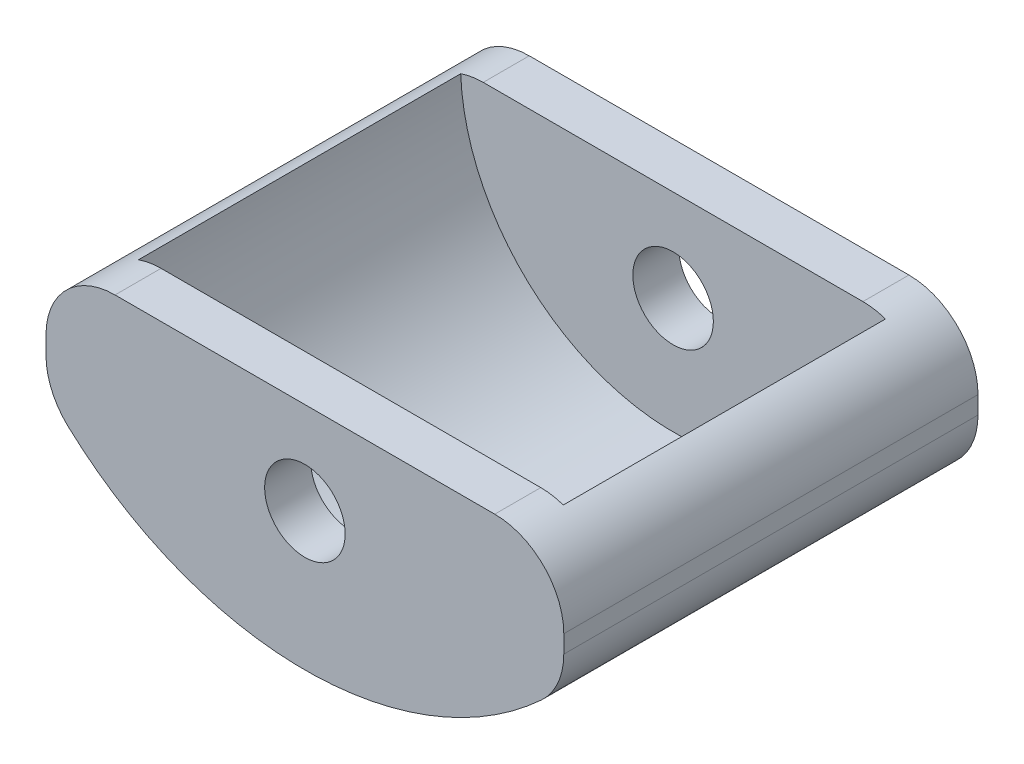
from build123d import *

# Parameters (mm, degrees)
SKETCH1_W               = 22.5
SKETCH1_H               = 18
BOSS_EXTRUDE1_DEPTH     = 10
CUT_EXTRUDE1_DEPTH      = 24.464068275
CUT_EXTRUDE1_DEPTH_BACK = 24.464068275
SKETCH2_R               = 1.75
CUT_EXTRUDE2_DEPTH      = 14
CUT_EXTRUDE3_REACH      = 19.532
SKETCH4_W               = 11.529065942
SKETCH4_H               = 14
FILLET1_R               = 3


with BuildPart() as part:
    # Sketch1 → Boss-Extrude1 (new body)
    with BuildSketch(Plane(origin=(0, 0, 0), x_dir=(1, 0, 0), z_dir=(0, 1, 0))):
        Rectangle(SKETCH1_W, SKETCH1_H)
    extrude(amount=BOSS_EXTRUDE1_DEPTH)

    # Sketch2 → Cut-Extrude1 (cut, two sides: drawn at the far end of the back side and taken through both)
    with BuildSketch(Plane.XY.offset(9).offset(-CUT_EXTRUDE1_DEPTH_BACK)):
        with Locations((0, 6)):
            Circle(SKETCH2_R)
        with BuildLine():
            Line((-11.25, 5), (-11.25, 0))
            Line((-11.25, 0), (11.25, 0))
            Line((11.25, 0), (11.25, 5))
            ThreePointArc((11.25, 5), (0, 0.01), (-11.25, 5))
        make_face()
    extrude(amount=CUT_EXTRUDE1_DEPTH + CUT_EXTRUDE1_DEPTH_BACK, mode=Mode.SUBTRACT)

    # Sketch3 → Cut-Extrude2 (cut)
    with BuildSketch(Plane.XY.offset(7)):
        with BuildLine():
            ThreePointArc((-9.233945582, 9.952114837), (0, 0.969656164), (9.233945582, 9.952114837))
            ThreePointArc((9.233945582, 9.952114837), (7.547885163, 11.733945582), (5.766054418, 10.047885163))
            ThreePointArc((5.766054418, 10.047885163), (0, 4.438869486), (-5.766054418, 10.047885163))
            ThreePointArc((-5.766054418, 10.047885163), (-7.547885163, 11.733945582), (-9.233945582, 9.952114837))
        make_face()
    extrude(amount=-CUT_EXTRUDE2_DEPTH, mode=Mode.SUBTRACT)

    # Sketch4 → Cut-Extrude3 (cut, up to next)
    with BuildSketch(Plane(origin=(0, 10, 0), x_dir=(1, 0, 0), z_dir=(0, 1, 0)), mode=Mode.PRIVATE) as cut_extrude3_sk1:
        Rectangle(SKETCH4_W, SKETCH4_H)
    cut_extrude3_tool1 = extrude(cut_extrude3_sk1.sketch, amount=-CUT_EXTRUDE3_REACH, mode=Mode.PRIVATE) & part.part
    add(cut_extrude3_tool1.solids().sort_by_distance((0, 10, 0))[0], mode=Mode.SUBTRACT)

    # Fillet1
    # the kernel refuses this fillet: 3 mm, written as the material it takes off along each edge
    with BuildSketch(Plane(origin=(11.25, 5, 12.435069568), x_dir=(0, 1, 0), z_dir=(0, 0, -1))) as fillet1_piece_1:
        with BuildLine():
            CenterArc((1.230754269, -3), FILLET1_R, 90, 47.349204062)
            ThreePointArc((-0.975735859, -0.967415115), (-0.498821765, -0.472659508), (0, 0))
            Line((0, 0), (1.230754269, 0))
        make_face()
    extrude(amount=24.870139136, mode=Mode.SUBTRACT)
    with BuildSketch(Plane(origin=(-11.25, 5, 12.435069568), x_dir=(0, 1, 0), z_dir=(0, 0, -1))) as fillet1_piece_2:
        with BuildLine():
            CenterArc((1.230754269, 3), FILLET1_R, 222.650795938, 47.349204062)
            ThreePointArc((-0.975735859, 0.967415115), (-0.498821765, 0.472659508), (0, 0))
            Line((0, 0), (1.230754269, 0))
        make_face()
    extrude(amount=24.870139136, mode=Mode.SUBTRACT)
    with BuildSketch(Plane(origin=(11.25, 10, -16.5), x_dir=(-1, 0, 0), z_dir=(0, 0, 1))) as fillet1_piece_3:
        with BuildLine():
            CenterArc((FILLET1_R, FILLET1_R), FILLET1_R, 180, 90)
            Line((0, FILLET1_R), (0, 0))
            Line((0, 0), (FILLET1_R, 0))
        make_face()
    extrude(amount=33, mode=Mode.SUBTRACT)
    with BuildSketch(Plane(origin=(-11.25, 10, 16.5), x_dir=(0, -1, 0), z_dir=(0, 0, -1))) as fillet1_piece_4:
        with BuildLine():
            CenterArc((FILLET1_R, -FILLET1_R), FILLET1_R, 90, 90)
            Line((0, -FILLET1_R), (0, 0))
            Line((0, 0), (FILLET1_R, 0))
        make_face()
    extrude(amount=33, mode=Mode.SUBTRACT)


solid = part.part
